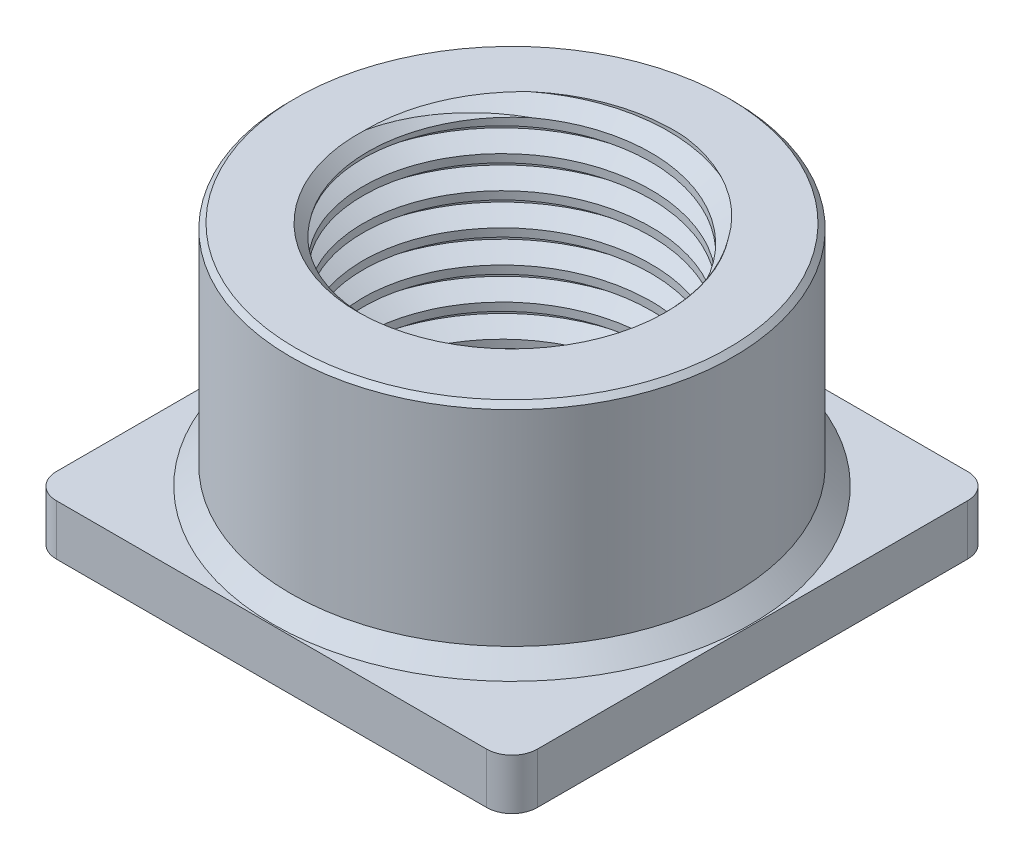
from build123d import *

# Parameters (mm, degrees)
SKETCH4_R           = 8.75
SKETCH4_R_2         = 5.69
BOSS_EXTRUDE1_DEPTH = 9
SKETCH7_W           = 19
SKETCH7_H           = 19
SKETCH7_R           = 6.75
BOSS_EXTRUDE2_DEPTH = 2
CHAMFER5_SIZE       = 1.06
THREAD1_PITCH       = 1.27
CHAMFER3_SIZE       = 0.2
FILLET1_R           = 1
CHAMFER4_SIZE       = 0.4
CHAMFER6_SIZE       = 0.7


with BuildPart() as part:
    # Sketch4 → Boss-Extrude1 (new body)
    with BuildSketch(Plane(origin=(0, 0, 0), x_dir=(1, 0, 0), z_dir=(0, 1, 0))):
        with Locations(Location((0, 0, 0), (0, 0, 270))):
            Circle(SKETCH4_R)
        with Locations(Location((0, 0, 0), (0, 0, 270))):
            Circle(SKETCH4_R_2, mode=Mode.SUBTRACT)
    extrude(amount=BOSS_EXTRUDE1_DEPTH)

    # Sketch7 → Boss-Extrude2 (add)
    with BuildSketch(Plane.XZ):
        Rectangle(SKETCH7_W, SKETCH7_H)
        with Locations(Location((0, 0, 0), (0, 0, 270))):
            Circle(SKETCH7_R, mode=Mode.SUBTRACT)
    extrude(amount=BOSS_EXTRUDE2_DEPTH)

    # Chamfer5
    chamfer5_edges = [part.edges().sort_by_distance(p)[0] for p in [
        (0, 0, 6.75),
    ]]
    chamfer(chamfer5_edges, length=CHAMFER5_SIZE - 0.0001)  # a hair under: the kernel refuses the full size

    # Thread1: the profile of Thread Profile1 profile screwed along a right-hand helix of 16.535433 turns, 8 arcs to a turn; built about Z, then put on its axis
    thread1_z = Axis((0, 0, 0), (0, 0, 1))
    thread1_corners = [(5.6897, 0, -0.000173205), (6.377407661, 0, 0.396874998), (6.377407661, 0, 0.555624998), (5.6897, 0, 0.952673202)]
    with BuildLine(mode=Mode.PRIVATE) as thread1_profile:
        Line(thread1_corners[0], thread1_corners[1])
        Line(thread1_corners[1], thread1_corners[2])
        Line(thread1_corners[2], thread1_corners[3])
        Line(thread1_corners[3], thread1_corners[0])
    thread1_cap = Face(thread1_profile.wire())
    thread1_turn_angles = [0, 22.5, 45, 67.5, 90, 112.5, 135, 157.5, 180, 202.5, 225, 247.5, 270, 292.5, 315, 337.5, 360]
    thread1_turn_weights = [1, 0.9238795325112867, 1, 0.9238795325112867, 1, 0.9238795325112867, 1, 0.9238795325112867, 1, 0.9238795325112867, 1, 0.9238795325112867, 1, 0.9238795325112867, 1, 0.9238795325112867, 1]
    thread1_turn_rails = [Edge.make_bspline([Vector(p[0], p[1], 0).rotate(thread1_z, thread1_turn_angles[k]) / thread1_turn_weights[k] + Vector(0, 0, p[2] + THREAD1_PITCH * thread1_turn_angles[k] / 360) for k in range(17)], [0, 0, 0, 1, 1, 2, 2, 3, 3, 4, 4, 5, 5, 6, 6, 7, 7, 8, 8, 8], 2, thread1_turn_weights) for p in thread1_corners]
    thread1_turn_sides = [Face.make_surface_from_curves(thread1_turn_rails[p[0]], thread1_turn_rails[p[1]]) for p in [(0, 1), (1, 2), (2, 3), (3, 0)]]
    thread1_last_angles = [5760, 5782.5, 5805, 5827.5, 5850, 5872.5, 5895, 5917.5, 5940, 5946.377952756, 5952.755905512]
    thread1_last_weights = [1, 0.9238795325112867, 1, 0.9238795325112867, 1, 0.9238795325112867, 1, 0.9238795325112867, 1, 0.9938107384973174, 1]
    thread1_last_rails = [Edge.make_bspline([Vector(p[0], p[1], 0).rotate(thread1_z, thread1_last_angles[k]) / thread1_last_weights[k] + Vector(0, 0, p[2] + THREAD1_PITCH * thread1_last_angles[k] / 360) for k in range(11)], [0, 0, 0, 1, 1, 2, 2, 3, 3, 4, 4, 5, 5, 5], 2, thread1_last_weights) for p in thread1_corners]
    thread1_last_sides = [Face.make_surface_from_curves(thread1_last_rails[p[0]], thread1_last_rails[p[1]]) for p in [(0, 1), (1, 2), (2, 3), (3, 0)]]
    thread1 = Plane(origin=(0, 11, 0), x_dir=(-1, 0, 0), z_dir=(0, -1, 0)) * Solid(Shell([*[p.moved(Location((0, 0, THREAD1_PITCH * i))) for i in range(16) for p in thread1_turn_sides], *thread1_last_sides, thread1_cap, thread1_cap.rotate(thread1_z, 5952.755905512).moved(Location((0, 0, THREAD1_PITCH * 5952.755905512 / 360)))]))
    add(thread1, mode=Mode.SUBTRACT)

    # Chamfer3
    chamfer3_edges = [part.edges().sort_by_distance(p)[0] for p in [
        (0, 9, -8.75),
    ]]
    chamfer(chamfer3_edges, length=CHAMFER3_SIZE)

    # Sketch6 → Cut-Revolve1 (revolve, cut)
    with BuildSketch(Plane.XY, mode=Mode.PRIVATE) as cut_revolve1_sk:
        Polygon((5.69, 9), (6.09, 9), (5.69, 8.6), align=None)
        Polygon((5.69, 0.4), (5.69, 0), (6.09, 0), align=None)
    revolve(cut_revolve1_sk.sketch.rotate(Axis((0, 0, 0), (0, 1, 0)), 211.689629733), axis=Axis((0, 0, 0), (0, 1, 0)), mode=Mode.SUBTRACT)

    # Fillet1
    fillet1_edges = [part.edges().sort_by_distance(p)[0] for p in [
        (9.5, -1, -9.5),
        (9.5, -1, 9.5),
        (-9.5, -1, 9.5),
        (-9.5, -1, -9.5),
    ]]
    fillet(fillet1_edges, radius=FILLET1_R)

    # Chamfer4
    chamfer4_edges = [part.edges().sort_by_distance(p)[0] for p in [
        (0, -2, 6.75),
    ]]
    chamfer(chamfer4_edges, length=CHAMFER4_SIZE)

    # Chamfer6
    chamfer6_edges = [part.edges().sort_by_distance(p)[0] for p in [
        (0, 0, -8.75),
    ]]
    chamfer(chamfer6_edges, length=CHAMFER6_SIZE)


solid = part.part
